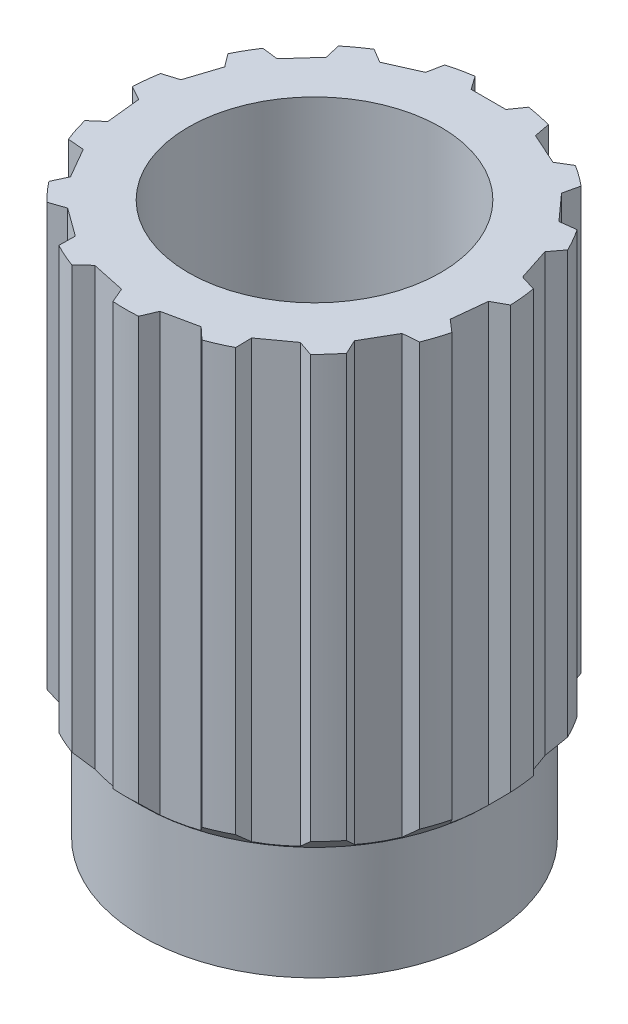
from build123d import *

# Parameters (mm, degrees)
ESQUISSE1_R             = 4.35
ESQUISSE1_R_2           = 2.9
BOSS_EXTRU_1_DEPTH      = 12.7
ESQUISSE2_OUTSIDE_W     = 14.236
ESQUISSE2_OUTSIDE_H     = 14.236
ESQUISSE2_OUTSIDE_R     = 3.95
ENL_V_MAT_EXTRU_1_DEPTH = 2
CHANFREIN1_SIZE         = 1
ENL_V_MAT_EXTRU_2_DEPTH = 15.111520117


with BuildPart() as part:
    # Esquisse1 → Boss.-Extru.1 (new body)
    with BuildSketch(Plane(origin=(0, 0, 0), x_dir=(1, 0, 0), z_dir=(0, 1, 0))):
        with Locations(Location((0, 0, 0), (0, 0, 270))):
            Circle(ESQUISSE1_R)
        with Locations(Location((0, 0, 0), (0, 0, 270))):
            Circle(ESQUISSE1_R_2, mode=Mode.SUBTRACT)
    extrude(amount=BOSS_EXTRU_1_DEPTH)

    # Esquisse2 outside → Enlèv. mat.-Extru.1 (cut)
    with BuildSketch(Plane.XZ):
        Rectangle(ESQUISSE2_OUTSIDE_W, ESQUISSE2_OUTSIDE_H)
        with Locations(Location((0, 0, 0), (0, 0, 270))):
            Circle(ESQUISSE2_OUTSIDE_R, mode=Mode.SUBTRACT)
    extrude(amount=-ENL_V_MAT_EXTRU_1_DEPTH, mode=Mode.SUBTRACT)

    # Chanfrein1
    # the kernel refuses this chamfer: 1 mm, written as the material it takes off along each edge
    with BuildSketch(Plane(origin=(0, 2, 0), x_dir=(0, 0, 1), z_dir=(1, 0, 0))) as chanfrein1_piece_1_section:
        Polygon((4.35, -CHANFREIN1_SIZE), (4.35 - CHANFREIN1_SIZE, 0), (4.35, 0), align=None)
    chanfrein1_piece_1 = revolve(axis=Axis((0, 2, 0), (0, -1, 0)), mode=Mode.PRIVATE)
    chanfrein1_piece_1 = chanfrein1_piece_1 - Plane(origin=(0, 2.799298708, 0), x_dir=(0, 0, -1), z_dir=(0, -1, 0)) * Cylinder(3.95, 18, mode=Mode.PRIVATE)
    add(chanfrein1_piece_1, mode=Mode.SUBTRACT)

    # Esquisse3 → Enlèv. mat.-Extru.2 (cut, through all)
    with BuildSketch(Plane(origin=(0, 12.7, 0), x_dir=(1, 0, 0), z_dir=(0, 1, 0))):
        Polygon((1, 4.856888804), (-1, 4.856888804), (-0.4, 4), (0.4, 4), align=None)
        Polygon((2.889020106, 4.030252062), (1.06192919, 4.843725348), (1.261528389, 3.816876488), (1.992364755, 3.491487173), align=None)
        Polygon((4.278502389, 2.506748125), (2.940241176, 3.993037776), (2.704927059, 2.973780356), (3.240231544, 2.379264495), align=None)
        Polygon((4.92819274, 0.549804664), (4.310158752, 2.451917697), (3.680619267, 1.616490584), (3.927832863, 0.855645371), align=None)
        Polygon((4.725753796, -1.502205018), (4.934810722, 0.486838772), (4.019898967, -0.020305095), (3.936276196, -0.815922611), align=None)
        Polygon((3.706189088, -3.294469806), (4.706189088, -1.562418998), (3.664101615, -1.653589838), (3.264101615, -2.346410162), align=None)
        Polygon((2.045790617, -4.517090835), (3.663824605, -3.34152033), (2.674747807, -3.000953877), (2.027534211, -3.471182078), align=None)
        Polygon((0.031656363, -4.958665822), (1.987951564, -4.54284244), (1.222905804, -3.829425727), (0.440387723, -3.995755079), align=None)
        Polygon((-1.987951564, -4.54284244), (-0.031656363, -4.958665822), (-0.440387723, -3.995755079), (-1.222905804, -3.829425727), align=None)
        Polygon((-3.663824605, -3.34152033), (-2.045790617, -4.517090835), (-2.027534211, -3.471182078), (-2.674747807, -3.000953877), align=None)
        Polygon((-4.706189088, -1.562418998), (-3.706189088, -3.294469806), (-3.264101615, -2.346410162), (-3.664101615, -1.653589838), align=None)
        Polygon((-4.934810722, 0.486838772), (-4.725753796, -1.502205018), (-3.936276196, -0.815922611), (-4.019898967, -0.020305095), align=None)
        Polygon((-4.310158752, 2.451917697), (-4.92819274, 0.549804664), (-3.927832863, 0.855645371), (-3.680619267, 1.616490584), align=None)
        Polygon((-2.940241176, 3.993037776), (-4.278502389, 2.506748125), (-3.240231544, 2.379264495), (-2.704927059, 2.973780356), align=None)
        Polygon((-1.06192919, 4.843725348), (-2.889020106, 4.030252062), (-1.992364755, 3.491487173), (-1.261528389, 3.816876488), align=None)
    extrude(amount=-ENL_V_MAT_EXTRU_2_DEPTH, mode=Mode.SUBTRACT)


solid = part.part
